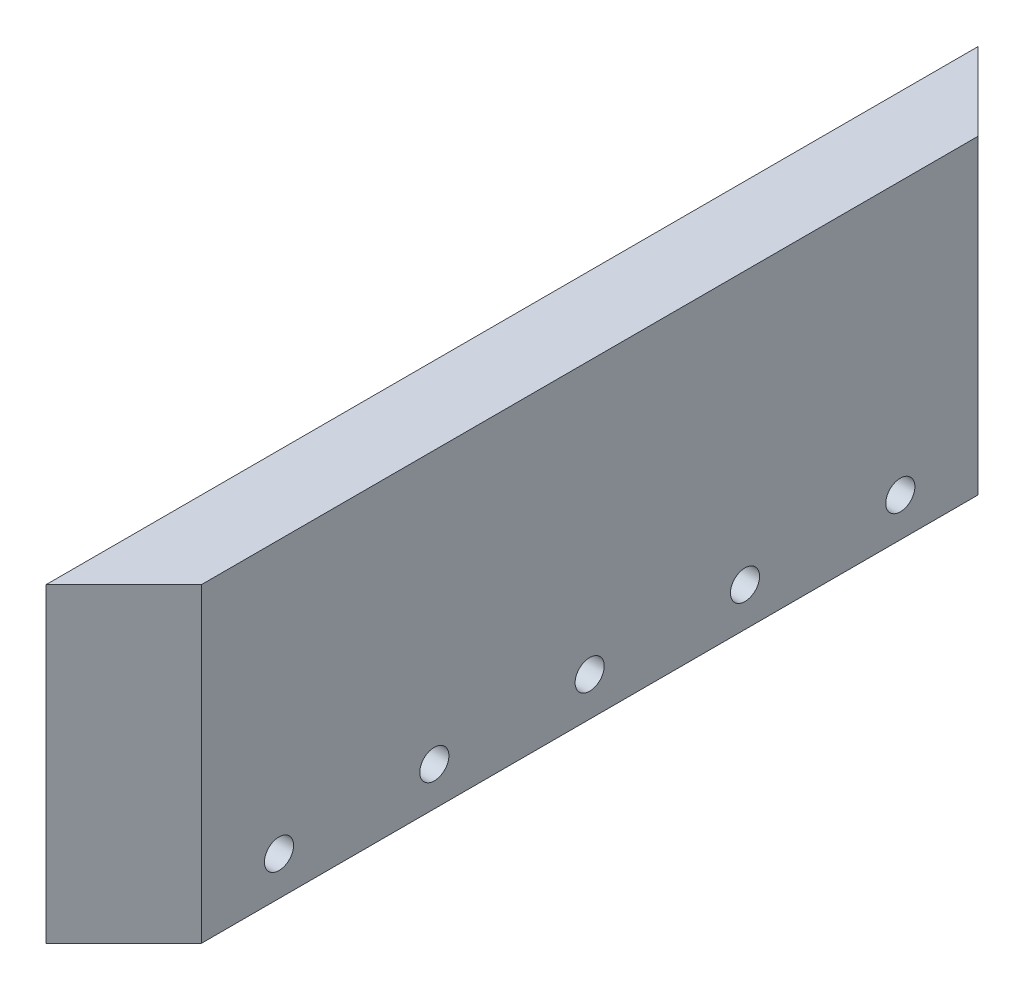
from build123d import *

# Parameters (mm, degrees)
SKETCH1_W           = 152.4
SKETCH1_H           = 50.8
BOSS_EXTRUDE1_DEPTH = 12.7
CUT_EXTRUDE1_DEPTH  = 93.457395594
SKETCH4_R           = 2.38125
CUT_EXTRUDE3_DEPTH  = 82.319677815
LPATTERN1_COUNT     = 5
LPATTERN1_PITCH     = 25.4


with BuildPart() as part:
    # Sketch1 → Boss-Extrude1 (new body)
    with BuildSketch(Plane(origin=(0, 0, 0), x_dir=(0, 0, -1), z_dir=(1, 0, 0))):
        Rectangle(SKETCH1_W, SKETCH1_H)
    extrude(amount=BOSS_EXTRUDE1_DEPTH)

    # Sketch2 → Cut-Extrude1 (cut, through all)
    with BuildSketch(Plane(origin=(0, 25.4, 0), x_dir=(1, 0, 0), z_dir=(0, 1, 0))):
        Polygon((0, 76.2), (12.7, 63.5), (12.7, 76.2), align=None)
        Polygon((0, -76.2), (12.7, -63.5), (12.7, -76.2), align=None)
    extrude(amount=-CUT_EXTRUDE1_DEPTH, mode=Mode.SUBTRACT)

    # Sketch4 → Cut-Extrude3 (cut, through all)
    with BuildSketch(Plane.ZY):
        with Locations((-50.8, -19.05)):
            Circle(SKETCH4_R)
    cut_extrude3 = extrude(amount=-CUT_EXTRUDE3_DEPTH, mode=Mode.SUBTRACT)

    # LPattern1: Cut-Extrude3 ×5
    with Locations(*[(0, 0, i * LPATTERN1_PITCH) for i in range(1, LPATTERN1_COUNT)]):
        add(cut_extrude3, mode=Mode.SUBTRACT)


solid = part.part
